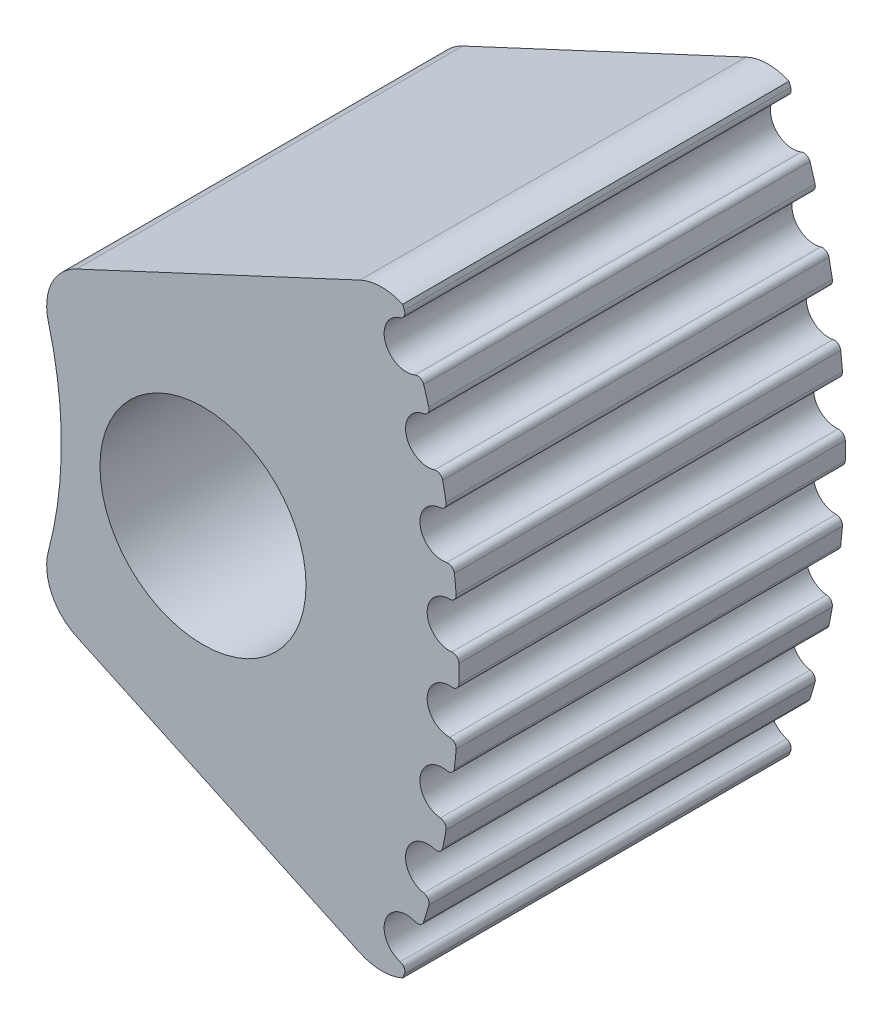
from build123d import *

# Parameters (mm, degrees)
CORPO_DEPTH                     = 15
REBAIXO_PARAFUSO_M4_D           = 4.5
REBAIXO_PARAFUSO_M4_DEPTH       = 30
REBAIXO_PARAFUSO_M4_CBORE_D     = 8
REBAIXO_PARAFUSO_M4_CBORE_DEPTH = 9
REBAIXO_PARAFUSO_M4_TIP         = 1.351936393
CORTE_DO_DENTE_DEPTH            = 37.341871168
CORTE_DOS_DENTES_COUNT          = 65


with BuildPart() as part:
    # Sketch1 → Corpo (new body)
    with BuildSketch(Plane.XY):
        with BuildLine():
            Line((15.584826044, 6.177594843), (26.596913538, 11.312615574))
            ThreePointArc((26.596913538, 11.312615574), (28.222086233, 11.341656746), (29.3321053, 10.154269972))
            ThreePointArc((29.3321053, 10.154269972), (31.04, 0), (29.3321053, -10.154269972))
            ThreePointArc((29.3321053, -10.154269972), (28.222086233, -11.341656746), (26.596913538, -11.312615574))
            Line((26.596913538, -11.312615574), (15.584826044, -6.177594843))
            ThreePointArc((15.584826044, -6.177594843), (14.618347125, -5.212143453), (14.49711403, -3.851452296))
            ThreePointArc((14.49711403, -3.851452296), (15, 0), (14.49711403, 3.851452296))
            ThreePointArc((14.49711403, 3.851452296), (14.618347125, 5.212143453), (15.584826044, 6.177594843))
        make_face()
    extrude(amount=CORPO_DEPTH)

    # Rebaixo - Parafuso M4
    with Locations(Plane.XY.offset(15)):
        with Locations((20.5, 0)):
            CounterBoreHole(REBAIXO_PARAFUSO_M4_D / 2, REBAIXO_PARAFUSO_M4_CBORE_D / 2, REBAIXO_PARAFUSO_M4_CBORE_DEPTH, depth=REBAIXO_PARAFUSO_M4_DEPTH)
            with Locations((0, 0, -(REBAIXO_PARAFUSO_M4_DEPTH + REBAIXO_PARAFUSO_M4_TIP / 2))):  # 118° drill point
                Cone(0, REBAIXO_PARAFUSO_M4_D / 2, REBAIXO_PARAFUSO_M4_TIP, mode=Mode.SUBTRACT)

    # Sketch7 → Corte do Dente (cut, through all)
    with BuildSketch(Plane.XY.offset(15)):
        with BuildLine():
            Line((30.44, 0), (31.04, 0))
            ThreePointArc((31.04, 0), (31.003732184, -1.500063545), (30.89501349, -2.996621675))
            Line((30.89501349, -2.996621675), (30.297816064, -2.938697287))
            ThreePointArc((30.297816064, -2.938697287), (30.313923237, -2.767608715), (30.329064298, -2.596431938))
            ThreePointArc((30.329064298, -2.596431938), (30.263747379, -2.405614811), (30.078824376, -2.325110409))
            ThreePointArc((30.078824376, -2.325110409), (29.205835344, -1.413075324), (30.162795139, -0.58957924))
            ThreePointArc((30.162795139, -0.58957924), (30.354626321, -0.527303457), (30.438059757, -0.343683367))
            ThreePointArc((30.438059757, -0.343683367), (30.439514935, -0.171844422), (30.44, 0))
        make_face()
    corte_do_dente = extrude(amount=-CORTE_DO_DENTE_DEPTH, mode=Mode.SUBTRACT)

    # Corte dos Dentes: Corte do Dente ×65 about axis
    corte_dos_dentes_axis = Axis((0, 0, 15), (0, 0, -1))
    for i in range(1, CORTE_DOS_DENTES_COUNT):
        add(corte_do_dente.rotate(corte_dos_dentes_axis, i * 360 / CORTE_DOS_DENTES_COUNT), mode=Mode.SUBTRACT)


solid = part.part
